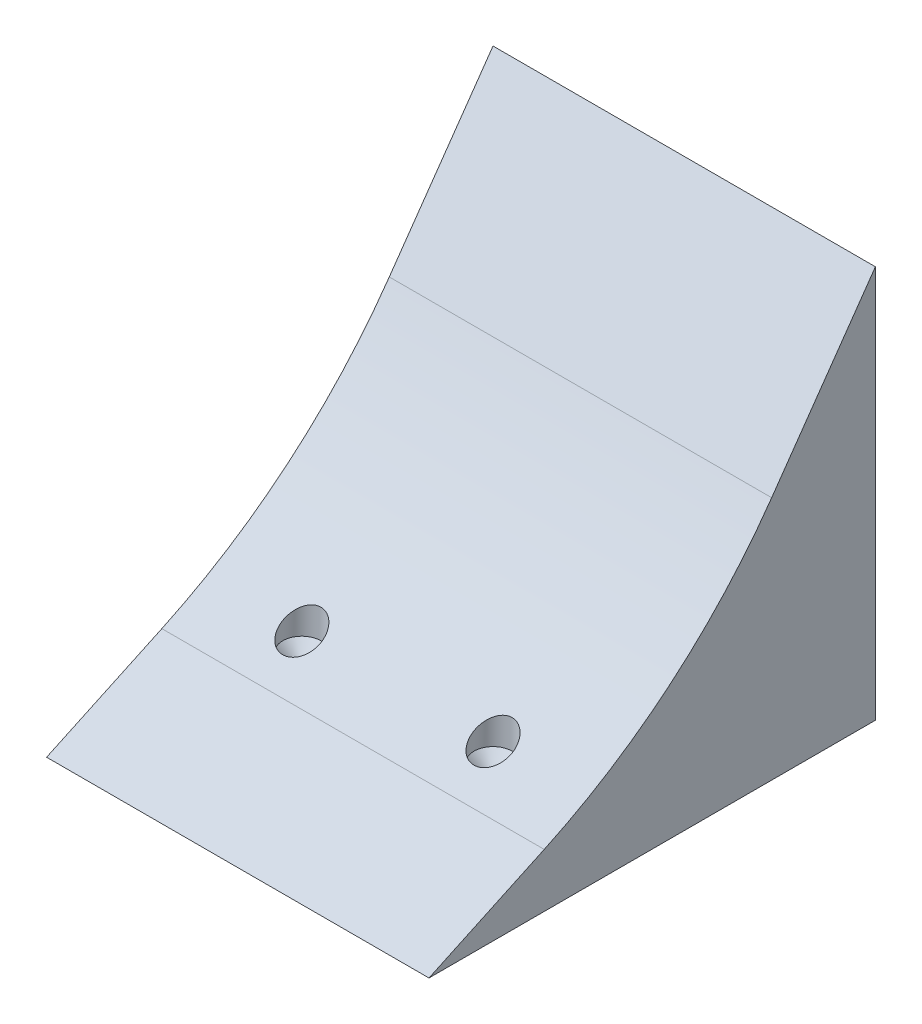
from build123d import *

# Parameters (mm, degrees)
BOSS_EXTRUDE1_DEPTH = 101.6
SKETCH2_R           = 1.905
CUT_EXTRUDE1_DEPTH  = 101.6
CUT_EXTRUDE2_START  = -12.7
SKETCH3_R           = 5.08
CUT_EXTRUDE2_DEPTH  = 101.6
CHAMFER1_SIZE       = 3.048


with BuildPart() as part:
    # Sketch1 → Boss-Extrude1 (new body)
    with BuildSketch(Plane(origin=(0, 0, 0), x_dir=(0, 0, -1), z_dir=(1, 0, 0))):
        with BuildLine():
            Line((-61.489643294, -124.315200567), (57.124090119, -124.315200567))
            Line((57.124090119, -124.315200567), (57.124090119, -19.966735992))
            Line((57.124090119, -19.966735992), (29.562861669, -59.328249467))
            ThreePointArc((29.562861669, -59.328249467), (2.684921835, -88.660373698), (-30.868886791, -110.036507311))
            Line((-30.868886791, -110.036507311), (-61.489643294, -124.315200567))
        make_face()
    extrude(amount=BOSS_EXTRUDE1_DEPTH)

    # Sketch2 → Cut-Extrude1 (cut)
    with BuildSketch(Plane.XZ.offset(124.315200567)):
        with Locations((25.4, 19.075909881)):
            Circle(SKETCH2_R)
        with Locations((76.2, 19.075909881)):
            Circle(SKETCH2_R)
    extrude(amount=-CUT_EXTRUDE1_DEPTH, mode=Mode.SUBTRACT)

    # Sketch3 → Cut-Extrude2 (cut)
    with BuildSketch(Plane.XZ.offset(124.315200567).offset(CUT_EXTRUDE2_START)):
        with Locations((25.4, 19.075909881)):
            Circle(SKETCH3_R)
        with Locations((76.2, 19.075909881)):
            Circle(SKETCH3_R)
    extrude(amount=-CUT_EXTRUDE2_DEPTH, mode=Mode.SUBTRACT)

    # Chamfer1
    chamfer1_edges = [part.edges().sort_by_distance(p)[0] for p in [
        (71.12, -111.615200567, 19.075909881),
        (20.32, -111.615200567, 19.075909881),
    ]]
    chamfer(chamfer1_edges, length=CHAMFER1_SIZE)


solid = part.part
